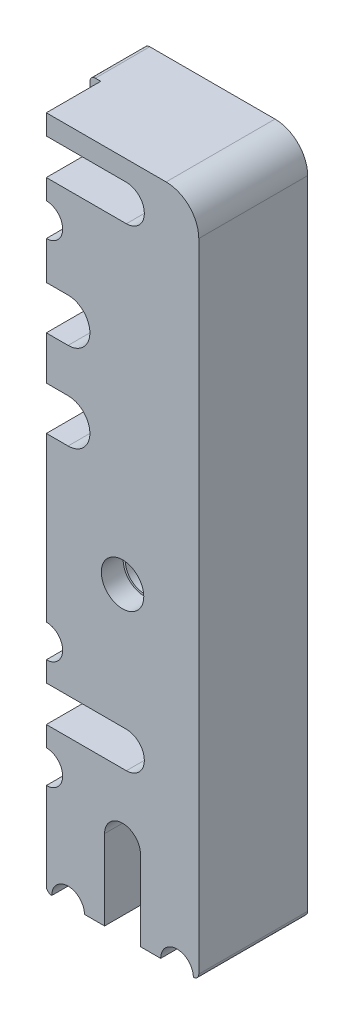
from build123d import *

# Parameters (mm, degrees)
SKETCH4_W           = 10
SKETCH4_H           = 62
BOSS_EXTRUDE1_DEPTH = 14
SKETCH10_W          = 1
SKETCH10_H          = 7
SKETCH10_W_2        = 7
SKETCH10_H_2        = 1
BOSS_EXTRUDE2_DEPTH = 5
CUT_EXTRUDE2_DEPTH  = 65.342831769
CUT_EXTRUDE6_DEPTH  = 65.342831769
SKETCH11_R          = 1.75
CUT_EXTRUDE7_DEPTH  = 8.5
SKETCH12_R          = 1.95
CUT_EXTRUDE8_DEPTH  = 2
CUT_EXTRUDE9_DEPTH  = 9
FILLET1_R           = 3
FILLET3_R           = 0.5


with BuildPart() as part:
    # Sketch4 → Boss-Extrude1 (new body)
    with BuildSketch(Plane(origin=(0, 0, 0), x_dir=(0, 0, -1), z_dir=(1, 0, 0))):
        with Locations((5, 31)):
            Rectangle(SKETCH4_W, SKETCH4_H)
    extrude(amount=BOSS_EXTRUDE1_DEPTH)

    # Sketch10 → Boss-Extrude2 (add)
    with BuildSketch(Plane(origin=(0, 0, -10), x_dir=(-1, 0, 0), z_dir=(0, 0, -1))):
        with Locations((0.5, 15)):
            Rectangle(SKETCH10_W, SKETCH10_H)
        with Locations((0.5, 58.5)):
            Rectangle(SKETCH10_W, SKETCH10_H)
        with Locations((-7, -0.5)):
            Rectangle(SKETCH10_W_2, SKETCH10_H_2)
    extrude(amount=-BOSS_EXTRUDE2_DEPTH)

    # Sketch5 → Cut-Extrude2 (cut, through all)
    with BuildSketch(Plane.XY):
        with BuildLine():
            Line((2, 44.5), (0, 44.5))
            Line((0, 44.5), (0, 48.5))
            Line((0, 48.5), (2, 48.5))
            ThreePointArc((2, 48.5), (4, 46.5), (2, 44.5))
        make_face()
        with BuildLine():
            Line((2, 36.5), (0, 36.5))
            Line((0, 36.5), (0, 40.5))
            Line((0, 40.5), (2, 40.5))
            ThreePointArc((2, 40.5), (4, 38.5), (2, 36.5))
        make_face()
    extrude(amount=-CUT_EXTRUDE2_DEPTH, mode=Mode.SUBTRACT)

    # Sketch9 → Cut-Extrude6 (cut, through all)
    with BuildSketch(Plane.XY):
        with BuildLine():
            Line((0, 52), (-1, 52))
            ThreePointArc((-1, 52), (-2.5, 53.5), (-1, 55))
            Line((-1, 55), (0, 55))
            ThreePointArc((0, 55), (1.5, 53.5), (0, 52))
        make_face()
        with BuildLine():
            Line((0, 18.5), (-1, 18.5))
            ThreePointArc((-1, 18.5), (-2.5, 20), (-1, 21.5))
            Line((-1, 21.5), (0, 21.5))
            ThreePointArc((0, 21.5), (1.5, 20), (0, 18.5))
        make_face()
        with BuildLine():
            Line((0, 8.5), (-1, 8.5))
            ThreePointArc((-1, 8.5), (-2.5, 10), (-1, 11.5))
            Line((-1, 11.5), (0, 11.5))
            ThreePointArc((0, 11.5), (1.5, 10), (0, 8.5))
        make_face()
        with BuildLine():
            Line((0.5, -1), (0.5, 0))
            ThreePointArc((0.5, 0), (2, 1.5), (3.5, 0))
            Line((3.5, 0), (3.5, -1))
            ThreePointArc((3.5, -1), (2, -2.5), (0.5, -1))
        make_face()
        with BuildLine():
            Line((13.5, 0), (13.5, -1))
            ThreePointArc((13.5, -1), (12, -2.5), (10.5, -1))
            Line((10.5, -1), (10.5, 0))
            ThreePointArc((10.5, 0), (12, 1.5), (13.5, 0))
        make_face()
    extrude(amount=-CUT_EXTRUDE6_DEPTH, mode=Mode.SUBTRACT)

    # Sketch11 → Cut-Extrude7 (cut)
    with BuildSketch(Plane.XY):
        with Locations((7, 28)):
            Circle(SKETCH11_R)
    extrude(amount=-CUT_EXTRUDE7_DEPTH, mode=Mode.SUBTRACT)

    # Sketch12 → Cut-Extrude8 (cut)
    with BuildSketch(Plane.XY):
        with Locations((7, 28)):
            Circle(SKETCH12_R)
    extrude(amount=-CUT_EXTRUDE8_DEPTH, mode=Mode.SUBTRACT)

    # Sketch13 → Cut-Extrude9 (cut)
    with BuildSketch(Plane.XY):
        with BuildLine():
            Line((8.65, 7.35), (8.65, -1))
            ThreePointArc((8.65, -1), (7, -2.65), (5.35, -1))
            Line((5.35, -1), (5.35, 7.35))
            ThreePointArc((5.35, 7.35), (7, 9), (8.65, 7.35))
        make_face()
        with BuildLine():
            Line((7.35, 13.35), (-1, 13.35))
            ThreePointArc((-1, 13.35), (-2.65, 15), (-1, 16.65))
            Line((-1, 16.65), (7.35, 16.65))
            ThreePointArc((7.35, 16.65), (9, 15), (7.35, 13.35))
        make_face()
        with BuildLine():
            Line((7.35, 56.85), (-1, 56.85))
            ThreePointArc((-1, 56.85), (-2.65, 58.5), (-1, 60.15))
            Line((-1, 60.15), (7.35, 60.15))
            ThreePointArc((7.35, 60.15), (9, 58.5), (7.35, 56.85))
        make_face()
    extrude(amount=-CUT_EXTRUDE9_DEPTH, mode=Mode.SUBTRACT)

    # Fillet1
    fillet1_edges = [part.edges().sort_by_distance(p)[0] for p in [
        (14, 62, -5),
    ]]
    fillet(fillet1_edges, radius=FILLET1_R)

    # Fillet3
    fillet3_edges = [part.edges().sort_by_distance(p)[0] for p in [
        (14, 0, -5),
        (0, 0, -5),
        (-1, 55, -7.5),
        (-1, 62, -7.5),
        (-1, 18.5, -7.5),
        (-1, 11.5, -7.5),
        (3.5, -1, -7.5),
        (10.5, -1, -7.5),
        (-1, 56.85, -7),
        (-1, 60.15, -7),
        (-1, 13.35, -7),
        (-1, 16.65, -7),
        (5.35, -1, -7),
        (8.65, -1, -7),
    ]]
    fillet(fillet3_edges, radius=FILLET3_R - 0.0001)  # a hair under: the kernel refuses the full size


solid = part.part
